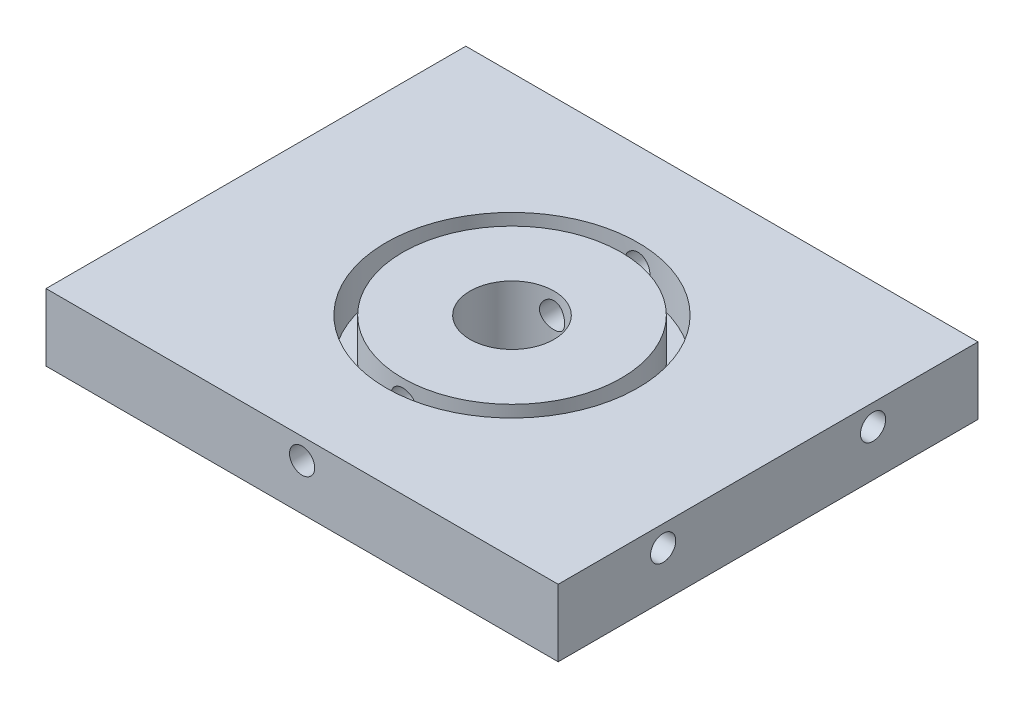
from build123d import *

# Parameters (mm, degrees)
ESQUISSE1_W             = 61
ESQUISSE1_H             = 8
BOSS_EXTRU_1_DEPTH      = 50
ESQUISSE2_R             = 15
ESQUISSE2_R_2           = 13
ENL_V_MAT_EXTRU_1_DEPTH = 5
ESQUISSE3_R             = 1.5
ENL_V_MAT_EXTRU_2_DEPTH = 10
ENL_V_START             = -10
ESQUISSE4_R             = 1.5
ENL_V_MAT_EXTRU_3_DEPTH = 10
ESQUISSE5_R             = 1.5
ENL_V_MAT_EXTRU_4_DEPTH = 92.592849066
ESQUISSE6_R             = 5
ENL_V_MAT_EXTRU_5_DEPTH = 76.128223791


with BuildPart() as part:
    # Esquisse1 → Boss.-Extru.1 (new body)
    with BuildSketch(Plane.XY):
        with Locations((25, -49)):
            Rectangle(ESQUISSE1_W, ESQUISSE1_H)
    extrude(amount=BOSS_EXTRU_1_DEPTH)

    # Esquisse2 → Enlèv. mat.-Extru.1 (cut)
    with BuildSketch(Plane(origin=(0, -45, 0), x_dir=(-1, 0, 0), z_dir=(0, 1, 0))):
        with Locations((-25, 25)):
            Circle(ESQUISSE2_R)
        with Locations((-25, 25)):
            Circle(ESQUISSE2_R_2, mode=Mode.SUBTRACT)
    extrude(amount=-ENL_V_MAT_EXTRU_1_DEPTH, mode=Mode.SUBTRACT)

    # Esquisse3 → Enlèv. mat.-Extru.2 (cut)
    with BuildSketch(Plane.ZY.offset(5.5)):
        with Locations((12.5, -47.5)):
            Circle(ESQUISSE3_R)
        with Locations((37.5, -47.5)):
            Circle(ESQUISSE3_R)
    extrude(amount=-ENL_V_MAT_EXTRU_2_DEPTH, mode=Mode.SUBTRACT)

    # Esquisse4 → Enlèv. mat.-Extru.3 (cut)
    with BuildSketch(Plane(origin=(55.5, 0, 0), x_dir=(0, 0, -1), z_dir=(1, 0, 0)).offset(ENL_V_START)):
        with Locations((-37.5, -47.5)):
            Circle(ESQUISSE4_R)
        with Locations((-12.5, -47.5)):
            Circle(ESQUISSE4_R)
    extrude(amount=ENL_V_MAT_EXTRU_3_DEPTH, mode=Mode.SUBTRACT)

    # Esquisse5 → Enlèv. mat.-Extru.4 (cut, through all)
    with BuildSketch(Plane(origin=(0, 0, 0), x_dir=(-1, 0, 0), z_dir=(0, 0, -1))):
        with Locations((-25, -47.5)):
            Circle(ESQUISSE5_R)
    extrude(amount=-ENL_V_MAT_EXTRU_4_DEPTH, mode=Mode.SUBTRACT)

    # Esquisse6 → Enlèv. mat.-Extru.5 (cut, through all)
    with BuildSketch(Plane(origin=(0, -45, 0), x_dir=(1, 0, 0), z_dir=(0, 1, 0))):
        with Locations((25, -25)):
            Circle(ESQUISSE6_R)
    extrude(amount=-ENL_V_MAT_EXTRU_5_DEPTH, mode=Mode.SUBTRACT)


solid = part.part
